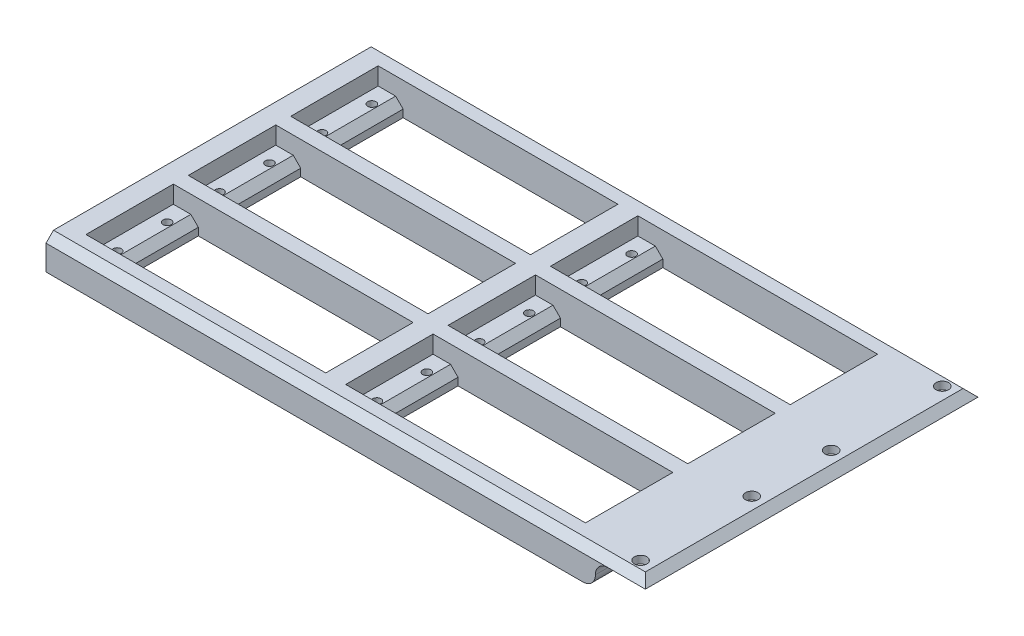
from build123d import *

# Parameters (mm, degrees)
SKETCH1_W                      = 240
SKETCH1_H                      = 133.2
BOSS_EXTRUDE1_DEPTH            = 13
SKETCH32_W                     = 20
SKETCH32_H                     = 133.2
CUT_EXTRUDE10_DEPTH            = 10
FILLET1_START                  = -68
FILLET1_DEPTH                  = 136
FILLET1_START_2                = -66.6
FILLET1_2_DEPTH                = 133.2
M6X1_0_TAPPED_HOLE1_D          = 5
M6X1_0_TAPPED_HOLE1_DEPTH      = 15
M6X1_0_TAPPED_HOLE1_TIP        = 1.502151548
SKETCH36_W                     = 96
SKETCH36_H                     = 35
CUT_EXTRUDE11_DEPTH            = 7
SKETCH37_W                     = 76
SKETCH37_H                     = 35
CUT_EXTRUDE12_DEPTH            = 144.991527529
M4X0_7_TAPPED_HOLE1_AT_2_COUNT = 2
M4X0_7_TAPPED_HOLE1_AT_2_PITCH = 20
M4X0_7_TAPPED_HOLE1_AT_3_COUNT = 2
M4X0_7_TAPPED_HOLE1_AT_3_PITCH = 86
M4X0_7_TAPPED_HOLE1_AT_4_COUNT = 2
M4X0_7_TAPPED_HOLE1_AT_4_PITCH = 88.294960219
LPATTERN1_COUNT                = 3
LPATTERN1_PITCH                = 41
LPATTERN1_COUNT_DIR2           = 2
LPATTERN1_PITCH_DIR2           = 104
CHAMFER1_SIZE                  = 3


with BuildPart() as part:
    # Sketch1 → Boss-Extrude1 (new body)
    with BuildSketch(Plane(origin=(0, 0, 0), x_dir=(1, 0, 0), z_dir=(0, 1, 0))):
        with Locations((7, 0)):
            Rectangle(SKETCH1_W, SKETCH1_H)
    extrude(amount=BOSS_EXTRUDE1_DEPTH)

    # Sketch32 → Cut-Extrude10 (cut)
    with BuildSketch(Plane.XZ):
        with Locations((117, 0)):
            Rectangle(SKETCH32_W, SKETCH32_H)
    extrude(amount=-CUT_EXTRUDE10_DEPTH, mode=Mode.SUBTRACT)

    # Fillet1: read off the stored shape, not the designer's step
    # Fillet1 outline → Fillet1 (cut)
    with BuildSketch(Plane.XY.offset(FILLET1_START)):
        with BuildLine():
            Line((107, 0), (107, 5))
            ThreePointArc((107, 5), (105.535533906, 1.464466094), (102, 0))
            Line((102, 0), (107, 0))
        make_face()
    extrude(amount=FILLET1_DEPTH, mode=Mode.SUBTRACT)

    # Fillet1 2 outline → Fillet1 2 (add)
    with BuildSketch(Plane.XY.offset(FILLET1_START_2)):
        with BuildLine():
            ThreePointArc((107, 5), (108.464466094, 8.535533906), (112, 10))
            Line((112, 10), (107, 10))
            Line((107, 10), (107, 5))
        make_face()
    extrude(amount=FILLET1_2_DEPTH)

    # M6x1.0 Tapped Hole1
    with Locations(Plane(origin=(0, 13, 0), x_dir=(1, 0, 0), z_dir=(0, 1, 0))):
        with Locations((119.05, 60.25), (119.05, 15.75), (119.05, -16.05), (119.05, -60.55)):
            Hole(M6X1_0_TAPPED_HOLE1_D / 2, depth=M6X1_0_TAPPED_HOLE1_DEPTH)
            with Locations((0, 0, -(M6X1_0_TAPPED_HOLE1_DEPTH + M6X1_0_TAPPED_HOLE1_TIP / 2))):  # 118° drill point
                Cone(0, M6X1_0_TAPPED_HOLE1_D / 2, M6X1_0_TAPPED_HOLE1_TIP, mode=Mode.SUBTRACT)

    # Sketch36 → Cut-Extrude11 (cut)
    with BuildSketch(Plane(origin=(0, 13, 0), x_dir=(1, 0, 0), z_dir=(0, 1, 0))):
        with Locations((-57, -41.1)):
            Rectangle(SKETCH36_W, SKETCH36_H)
        with Locations((-57, -0.1)):
            Rectangle(SKETCH36_W, SKETCH36_H)
        with Locations((-57, 40.9)):
            Rectangle(SKETCH36_W, SKETCH36_H)
        with Locations((47, 40.9)):
            Rectangle(SKETCH36_W, SKETCH36_H)
        with Locations((47, -0.1)):
            Rectangle(SKETCH36_W, SKETCH36_H)
        with Locations((47, -41.1)):
            Rectangle(SKETCH36_W, SKETCH36_H)
    extrude(amount=-CUT_EXTRUDE11_DEPTH, mode=Mode.SUBTRACT)

    # Sketch37 → Cut-Extrude12 (cut, through all)
    with BuildSketch(Plane(origin=(0, 13, 0), x_dir=(1, 0, 0), z_dir=(0, 1, 0))):
        with Locations((-57, -41.1)):
            Rectangle(SKETCH37_W, SKETCH37_H)
        with Locations((-57, -0.1)):
            Rectangle(SKETCH37_W, SKETCH37_H)
        with Locations((-57, 40.9)):
            Rectangle(SKETCH37_W, SKETCH37_H)
        with Locations((47, -0.1)):
            Rectangle(SKETCH37_W, SKETCH37_H)
        with Locations((47, -41.1)):
            Rectangle(SKETCH37_W, SKETCH37_H)
        with Locations((47, 40.9)):
            Rectangle(SKETCH37_W, SKETCH37_H)
    extrude(amount=-CUT_EXTRUDE12_DEPTH, mode=Mode.SUBTRACT)

    # Sketch39 → M4x0.7 Tapped Hole1 (revolve, cut)
    with BuildSketch(Plane(origin=(-100, 6, 51.1), x_dir=(0, 0, 1), z_dir=(1, 0, 0))):
        Polygon((0, 0), (0, 11.091420021), (1.65, 10.1), (1.65, 0), align=None)
    m4x0_7_tapped_hole1 = revolve(axis=Axis((-100, 12.35, 51.1), (0, -1, 0)), mode=Mode.SUBTRACT)

    # M4x0.7 Tapped Hole1 at 2: M4x0.7 Tapped Hole1 ×2
    with Locations(*[(0, 0, -i * M4X0_7_TAPPED_HOLE1_AT_2_PITCH) for i in range(1, M4X0_7_TAPPED_HOLE1_AT_2_COUNT)]):
        add(m4x0_7_tapped_hole1, mode=Mode.SUBTRACT)

    # M4x0.7 Tapped Hole1 at 3: M4x0.7 Tapped Hole1 ×2
    with Locations(*[(i * M4X0_7_TAPPED_HOLE1_AT_3_PITCH, 0, 0) for i in range(1, M4X0_7_TAPPED_HOLE1_AT_3_COUNT)]):
        add(m4x0_7_tapped_hole1, mode=Mode.SUBTRACT)

    # M4x0.7 Tapped Hole1 at 4: M4x0.7 Tapped Hole1 ×2
    with Locations(*[Vector(0.9740080270391964, 0, -0.22651349466027837) * (i * M4X0_7_TAPPED_HOLE1_AT_4_PITCH) for i in range(1, M4X0_7_TAPPED_HOLE1_AT_4_COUNT)]):
        add(m4x0_7_tapped_hole1, mode=Mode.SUBTRACT)

    # LPattern1: M4x0.7 Tapped Hole1 3 × 2
    with Locations(*[(j * LPATTERN1_PITCH_DIR2, 0, -i * LPATTERN1_PITCH) for i in range(LPATTERN1_COUNT) for j in range(LPATTERN1_COUNT_DIR2) if (i, j) != (0, 0)]):
        add(m4x0_7_tapped_hole1, mode=Mode.SUBTRACT)

    # LPattern1 copy 1 sketch → LPattern1 copy 1 (revolve, cut)
    with BuildSketch(Plane(origin=(4, 6, 31.1), x_dir=(0, 0, 1), z_dir=(1, 0, 0))):
        Polygon((0, 0), (0, 11.091420021), (1.65, 10.1), (1.65, 0), align=None)
    revolve(axis=Axis((4, 12.35, 31.1), (0, -1, 0)), mode=Mode.SUBTRACT)

    # LPattern1 copy 2 sketch → LPattern1 copy 2 (revolve, cut)
    with BuildSketch(Plane(origin=(-100, 6, -9.9), x_dir=(0, 0, 1), z_dir=(1, 0, 0))):
        Polygon((0, 0), (0, 11.091420021), (1.65, 10.1), (1.65, 0), align=None)
    revolve(axis=Axis((-100, 12.35, -9.9), (0, -1, 0)), mode=Mode.SUBTRACT)

    # LPattern1 copy 3 sketch → LPattern1 copy 3 (revolve, cut)
    with BuildSketch(Plane(origin=(4, 6, -9.9), x_dir=(0, 0, 1), z_dir=(1, 0, 0))):
        Polygon((0, 0), (0, 11.091420021), (1.65, 10.1), (1.65, 0), align=None)
    revolve(axis=Axis((4, 12.35, -9.9), (0, -1, 0)), mode=Mode.SUBTRACT)

    # LPattern1 copy 4 sketch → LPattern1 copy 4 (revolve, cut)
    with BuildSketch(Plane(origin=(-100, 6, -50.9), x_dir=(0, 0, 1), z_dir=(1, 0, 0))):
        Polygon((0, 0), (0, 11.091420021), (1.65, 10.1), (1.65, 0), align=None)
    revolve(axis=Axis((-100, 12.35, -50.9), (0, -1, 0)), mode=Mode.SUBTRACT)

    # LPattern1 copy 5 sketch → LPattern1 copy 5 (revolve, cut)
    with BuildSketch(Plane(origin=(4, 6, -50.9), x_dir=(0, 0, 1), z_dir=(1, 0, 0))):
        Polygon((0, 0), (0, 11.091420021), (1.65, 10.1), (1.65, 0), align=None)
    revolve(axis=Axis((4, 12.35, -50.9), (0, -1, 0)), mode=Mode.SUBTRACT)

    # LPattern1 copy 6 sketch → LPattern1 copy 6 (revolve, cut)
    with BuildSketch(Plane(origin=(90, 6, 51.1), x_dir=(0, 0, 1), z_dir=(1, 0, 0))):
        Polygon((0, 0), (0, 11.091420021), (1.65, 10.1), (1.65, 0), align=None)
    revolve(axis=Axis((90, 12.35, 51.1), (0, -1, 0)), mode=Mode.SUBTRACT)

    # LPattern1 copy 7 sketch → LPattern1 copy 7 (revolve, cut)
    with BuildSketch(Plane(origin=(-14, 6, 10.1), x_dir=(0, 0, 1), z_dir=(1, 0, 0))):
        Polygon((0, 0), (0, 11.091420021), (1.65, 10.1), (1.65, 0), align=None)
    revolve(axis=Axis((-14, 12.35, 10.1), (0, -1, 0)), mode=Mode.SUBTRACT)

    # LPattern1 copy 8 sketch → LPattern1 copy 8 (revolve, cut)
    with BuildSketch(Plane(origin=(90, 6, 10.1), x_dir=(0, 0, 1), z_dir=(1, 0, 0))):
        Polygon((0, 0), (0, 11.091420021), (1.65, 10.1), (1.65, 0), align=None)
    revolve(axis=Axis((90, 12.35, 10.1), (0, -1, 0)), mode=Mode.SUBTRACT)

    # LPattern1 copy 9 sketch → LPattern1 copy 9 (revolve, cut)
    with BuildSketch(Plane(origin=(-14, 6, -30.9), x_dir=(0, 0, 1), z_dir=(1, 0, 0))):
        Polygon((0, 0), (0, 11.091420021), (1.65, 10.1), (1.65, 0), align=None)
    revolve(axis=Axis((-14, 12.35, -30.9), (0, -1, 0)), mode=Mode.SUBTRACT)

    # LPattern1 copy 10 sketch → LPattern1 copy 10 (revolve, cut)
    with BuildSketch(Plane(origin=(90, 6, -30.9), x_dir=(0, 0, 1), z_dir=(1, 0, 0))):
        Polygon((0, 0), (0, 11.091420021), (1.65, 10.1), (1.65, 0), align=None)
    revolve(axis=Axis((90, 12.35, -30.9), (0, -1, 0)), mode=Mode.SUBTRACT)

    # LPattern1 copy 11 sketch → LPattern1 copy 11 (revolve, cut)
    with BuildSketch(Plane(origin=(90, 6, 31.1), x_dir=(0, 0, 1), z_dir=(1, 0, 0))):
        Polygon((0, 0), (0, 11.091420021), (1.65, 10.1), (1.65, 0), align=None)
    revolve(axis=Axis((90, 12.35, 31.1), (0, -1, 0)), mode=Mode.SUBTRACT)

    # LPattern1 copy 12 sketch → LPattern1 copy 12 (revolve, cut)
    with BuildSketch(Plane(origin=(-14, 6, -9.9), x_dir=(0, 0, 1), z_dir=(1, 0, 0))):
        Polygon((0, 0), (0, 11.091420021), (1.65, 10.1), (1.65, 0), align=None)
    revolve(axis=Axis((-14, 12.35, -9.9), (0, -1, 0)), mode=Mode.SUBTRACT)

    # LPattern1 copy 13 sketch → LPattern1 copy 13 (revolve, cut)
    with BuildSketch(Plane(origin=(90, 6, -9.9), x_dir=(0, 0, 1), z_dir=(1, 0, 0))):
        Polygon((0, 0), (0, 11.091420021), (1.65, 10.1), (1.65, 0), align=None)
    revolve(axis=Axis((90, 12.35, -9.9), (0, -1, 0)), mode=Mode.SUBTRACT)

    # LPattern1 copy 14 sketch → LPattern1 copy 14 (revolve, cut)
    with BuildSketch(Plane(origin=(-14, 6, -50.9), x_dir=(0, 0, 1), z_dir=(1, 0, 0))):
        Polygon((0, 0), (0, 11.091420021), (1.65, 10.1), (1.65, 0), align=None)
    revolve(axis=Axis((-14, 12.35, -50.9), (0, -1, 0)), mode=Mode.SUBTRACT)

    # LPattern1 copy 15 sketch → LPattern1 copy 15 (revolve, cut)
    with BuildSketch(Plane(origin=(90, 6, -50.9), x_dir=(0, 0, 1), z_dir=(1, 0, 0))):
        Polygon((0, 0), (0, 11.091420021), (1.65, 10.1), (1.65, 0), align=None)
    revolve(axis=Axis((90, 12.35, -50.9), (0, -1, 0)), mode=Mode.SUBTRACT)

    # Chamfer1
    chamfer1_edges = [part.edges().sort_by_distance(p)[0] for p in [
        (-95, 6, -40.9),
        (-19, 6, -40.9),
        (-95, 6, 0.1),
        (-19, 6, 0.1),
        (-19, 6, 41.1),
        (-95, 6, 41.1),
        (9, 6, -40.9),
        (85, 6, -40.9),
        (85, 6, 0.1),
        (9, 6, 0.1),
        (9, 6, 41.1),
        (85, 6, 41.1),
        (7, 13, -66.6),
        (127, 13, 0),
        (7, 13, 66.6),
    ]]
    chamfer(chamfer1_edges, length=CHAMFER1_SIZE - 0.0001)  # a hair under: the kernel refuses the full size


solid = part.part
